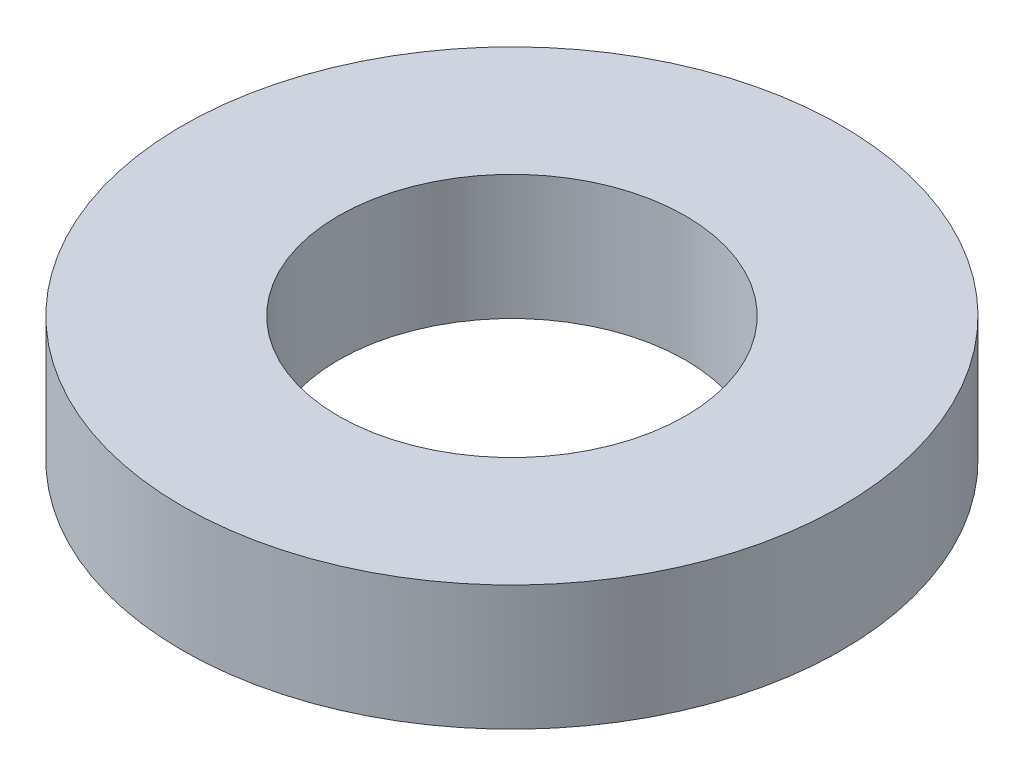
from build123d import *

# Parameters (mm, degrees)
SKETCH1_R           = 47.5
BOSS_EXTRUDE1_DEPTH = 18
SKETCH2_R           = 25
CUT_EXTRUDE1_DEPTH  = 70.544949493


with BuildPart() as part:
    # Sketch1 → Boss-Extrude1 (new body)
    with BuildSketch(Plane(origin=(0, 0, 0), x_dir=(1, 0, 0), z_dir=(0, 1, 0))):
        Circle(SKETCH1_R)
    extrude(amount=BOSS_EXTRUDE1_DEPTH)

    # Sketch2 → Cut-Extrude1 (cut, through all)
    with BuildSketch(Plane(origin=(0, 0, 0), x_dir=(1, 0, 0), z_dir=(0, 1, 0))):
        Circle(SKETCH2_R)
    extrude(amount=CUT_EXTRUDE1_DEPTH, mode=Mode.SUBTRACT)


solid = part.part
